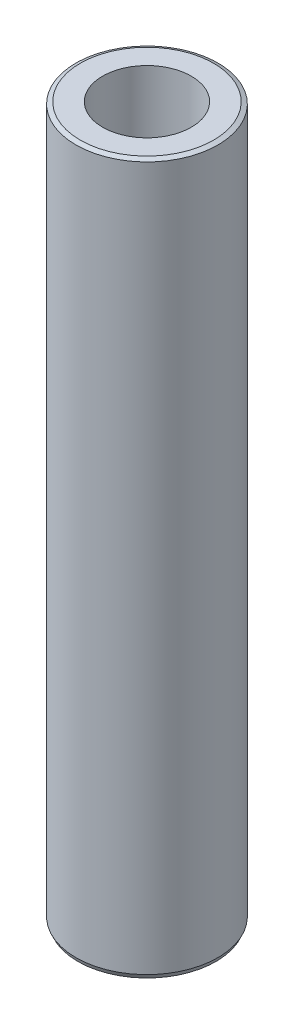
from build123d import *
from OCP.BRepFilletAPI import BRepFilletAPI_MakeChamfer

# Parameters (mm, degrees)
SKETCH1_R           = 60
BOSS_EXTRUDE1_DEPTH = 600
SKETCH2_R           = 37.449004428
CUT_EXTRUDE1_DEPTH  = 606.970296302
CHAMFER1_SIZE       = 1.676204563
CHAMFER1_SIZE2      = 3.678821377


with BuildPart() as part:
    # Sketch1 → Boss-Extrude1 (new body)
    with BuildSketch(Plane(origin=(0, 0, 0), x_dir=(1, 0, 0), z_dir=(0, 1, 0))):
        Circle(SKETCH1_R)
    extrude(amount=BOSS_EXTRUDE1_DEPTH)

    # Sketch2 → Cut-Extrude1 (cut, through all)
    with BuildSketch(Plane(origin=(0, 0, 0), x_dir=(1, 0, 0), z_dir=(0, 1, 0))):
        Circle(SKETCH2_R)
    extrude(amount=CUT_EXTRUDE1_DEPTH, mode=Mode.SUBTRACT)

    # Chamfer1: one chamfer whose edges measure the first distance from different faces: ONE call of the kernel's chamfer builder (chamfer() names one face for all edges)
    chamfer1_edges_1 = [part.edges().sort_by_distance(p)[0] for p in [
        (-60, 600, 0),
    ]]
    chamfer1_side_1 = [part.faces().sort_by_distance(p)[0] for p in [
        (-60, 300, 0),
    ]]
    chamfer1_edges_2 = [part.edges().sort_by_distance(p)[0] for p in [
        (-60, 0, 0),
    ]]
    chamfer1_side_2 = [part.faces().sort_by_distance(p)[0] for p in [
        (-58.302943725, 0, 0),
    ]]
    chamfer1 = BRepFilletAPI_MakeChamfer(part.part.solid().wrapped)
    for e in chamfer1_edges_1:
        chamfer1.Add(CHAMFER1_SIZE, CHAMFER1_SIZE2, e.wrapped, chamfer1_side_1[0].wrapped)  # the first distance lies on this face
    for e in chamfer1_edges_2:
        chamfer1.Add(CHAMFER1_SIZE, CHAMFER1_SIZE2, e.wrapped, chamfer1_side_2[0].wrapped)  # the first distance lies on this face
    add(Compound.cast(chamfer1.Shape()), mode=Mode.REPLACE)


solid = part.part
